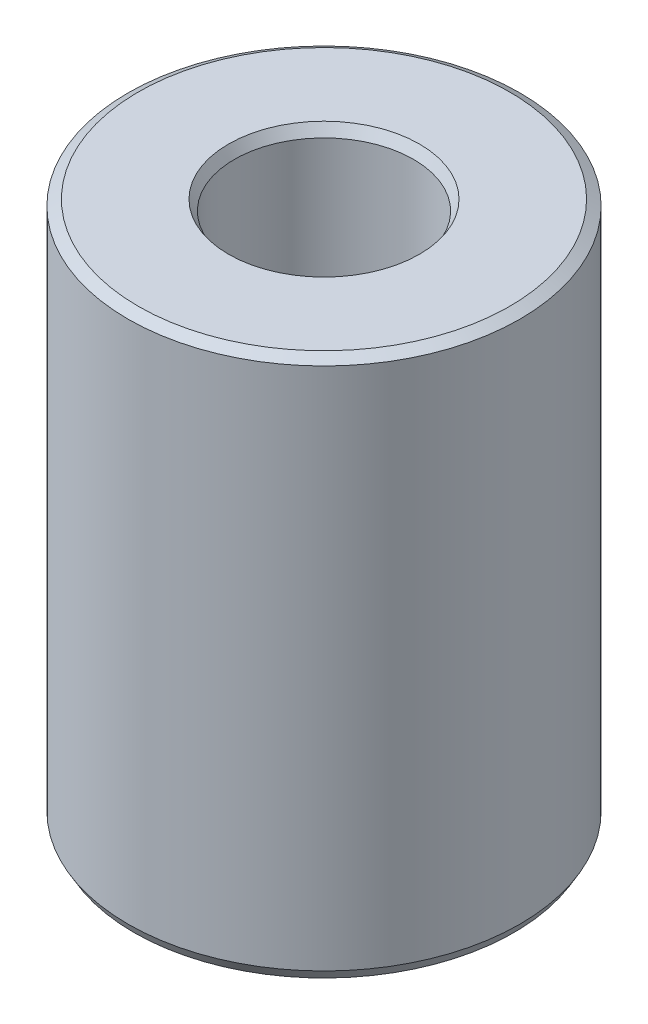
from build123d import *
from OCP.BRepFilletAPI import BRepFilletAPI_MakeChamfer

# Parameters (mm, degrees)
SKETCH1_R           = 30
BOSS_EXTRUDE1_DEPTH = 82.693193145
SKETCH2_R           = 13.710344357
CUT_EXTRUDE1_DEPTH  = 93.941724713
CHAMFER1_SIZE       = 0.908588744
CHAMFER1_SIZE2      = 1.573721868


with BuildPart() as part:
    # Sketch1 → Boss-Extrude1 (new body)
    with BuildSketch(Plane(origin=(0, 0, 0), x_dir=(1, 0, 0), z_dir=(0, 1, 0))):
        Circle(SKETCH1_R)
    extrude(amount=BOSS_EXTRUDE1_DEPTH)

    # Sketch2 → Cut-Extrude1 (cut, through all)
    with BuildSketch(Plane(origin=(0, 0, 0), x_dir=(1, 0, 0), z_dir=(0, 1, 0))):
        Circle(SKETCH2_R)
    extrude(amount=CUT_EXTRUDE1_DEPTH, mode=Mode.SUBTRACT)

    # Chamfer1: one chamfer whose edges measure the first distance from different faces: ONE call of the kernel's chamfer builder (chamfer() names one face for all edges)
    chamfer1_edges_1 = [part.edges().sort_by_distance(p)[0] for p in [
        (-13.710344357, 82.693193145, 0),
    ]]
    chamfer1_side_1 = [part.faces().sort_by_distance(p)[0] for p in [
        (-29.151471863, 82.693193145, 0),
    ]]
    chamfer1_edges_2 = [part.edges().sort_by_distance(p)[0] for p in [
        (-13.710344357, 0, 0),
    ]]
    chamfer1_side_2 = [part.faces().sort_by_distance(p)[0] for p in [
        (-13.710344357, 41.346596573, 0),
    ]]
    chamfer1_edges_3 = [part.edges().sort_by_distance(p)[0] for p in [
        (-30, 0, 0),
    ]]
    chamfer1_side_3 = [part.faces().sort_by_distance(p)[0] for p in [
        (-29.151471863, 0, 0),
    ]]
    chamfer1_edges_4 = [part.edges().sort_by_distance(p)[0] for p in [
        (-30, 82.693193145, 0),
    ]]
    chamfer1_side_4 = [part.faces().sort_by_distance(p)[0] for p in [
        (-30, 41.346596573, 0),
    ]]
    chamfer1 = BRepFilletAPI_MakeChamfer(part.part.solid().wrapped)
    for e in chamfer1_edges_1:
        chamfer1.Add(CHAMFER1_SIZE, CHAMFER1_SIZE2, e.wrapped, chamfer1_side_1[0].wrapped)  # the first distance lies on this face
    for e in chamfer1_edges_2:
        chamfer1.Add(CHAMFER1_SIZE, CHAMFER1_SIZE2, e.wrapped, chamfer1_side_2[0].wrapped)  # the first distance lies on this face
    for e in chamfer1_edges_3:
        chamfer1.Add(CHAMFER1_SIZE, CHAMFER1_SIZE2, e.wrapped, chamfer1_side_3[0].wrapped)  # the first distance lies on this face
    for e in chamfer1_edges_4:
        chamfer1.Add(CHAMFER1_SIZE, CHAMFER1_SIZE2, e.wrapped, chamfer1_side_4[0].wrapped)  # the first distance lies on this face
    add(Compound.cast(chamfer1.Shape()), mode=Mode.REPLACE)


solid = part.part
